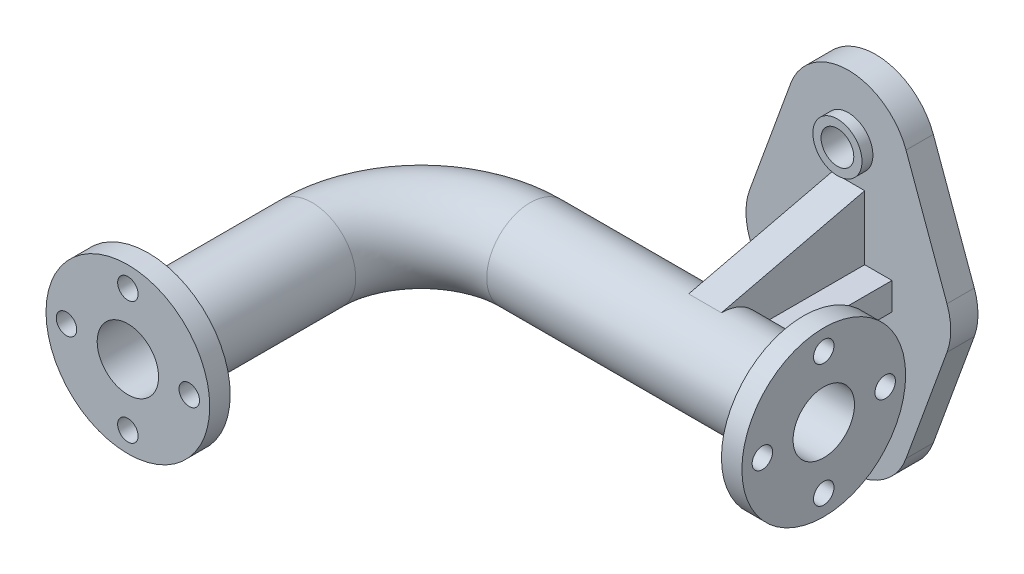
from build123d import *

# Parameters (mm, degrees)
SWEEP_THIN1_PROFILE_R    = 32
SWEEP_THIN1_PROFILE_R_2  = 22.5
BOSS_EXTRUDE1_START      = -15
SKETCH14_R               = 60
SKETCH14_R_2             = 22.5
SKETCH14_R_3             = 7.5
BOSS_EXTRUDE1_DEPTH      = 15
BOSS_EXTRUDE2_START      = 15
SKETCH15_R               = 60
SKETCH15_R_2             = 7.5
SKETCH15_R_3             = 22.5
BOSS_EXTRUDE2_DEPTH      = 15
SKETCH16_R               = 12
BOSS_EXTRUDE3_DEPTH      = 20
EXTRUDE_THIN1_REACH      = 455.521
EXTRUDE_THIN1_END_RADIUS = 32
SKETCH17_W               = 64
SKETCH17_H               = 20
RIB1_START               = -12
RIB1_DEPTH               = 24
SKETCH20_R               = 18
SKETCH20_R_2             = 12
BOSS_EXTRUDE4_DEPTH      = 8


# Read off the part's stored shape, not the designer's step: Rib1
with BuildPart() as part:
    # Sweep-Thin1: sweep along a path in Sketch1
    with BuildLine(Plane(origin=(0, 0, 0), x_dir=(-1, 0, 0), z_dir=(0, 1, 0))) as sweep_thin1_path:
        Line((0, 0), (0, -135))
        ThreePointArc((0, -135), (-23.431457505, -191.568542495), (-80, -215))
        Line((-80, -215), (-280, -215))
    # Sweep-Thin1 profile (on start of the path) → Sweep-Thin1 (sweep)
    with BuildSketch(Plane(origin=(0, 0, 0), x_dir=(-1, 0, 0), z_dir=(0, 0, -1))):
        Circle(SWEEP_THIN1_PROFILE_R)
        Circle(SWEEP_THIN1_PROFILE_R_2, mode=Mode.SUBTRACT)
    sweep(path=sweep_thin1_path.line)

    # Sketch14 → Boss-Extrude1 (add)
    with BuildSketch(Plane.XY.offset(BOSS_EXTRUDE1_START)):
        Circle(SKETCH14_R)
        with Locations(Location((0, 0, 0), (0, 0, 180))):
            Circle(SKETCH14_R_2, mode=Mode.SUBTRACT)
        with Locations((0, -45)):
            Circle(SKETCH14_R_3, mode=Mode.SUBTRACT)
        with Locations((-45, 0)):
            Circle(SKETCH14_R_3, mode=Mode.SUBTRACT)
        with Locations((0, 45)):
            Circle(SKETCH14_R_3, mode=Mode.SUBTRACT)
        with Locations((45, 0)):
            Circle(SKETCH14_R_3, mode=Mode.SUBTRACT)
    extrude(amount=BOSS_EXTRUDE1_DEPTH)

    # Sketch15 → Boss-Extrude2 (add)
    with BuildSketch(Plane.YZ.offset(280).offset(BOSS_EXTRUDE2_START)):
        with Locations(Location((0, -215, 0), (0, 0, 270))):
            Circle(SKETCH15_R)
        with Locations(Location((0, -260, 0), (0, 0, 270))):
            Circle(SKETCH15_R_2, mode=Mode.SUBTRACT)
        with Locations(Location((0, -215, 0), (0, 0, 270))):
            Circle(SKETCH15_R_3, mode=Mode.SUBTRACT)
        with Locations(Location((-45, -215, 0), (0, 0, 270))):
            Circle(SKETCH15_R_2, mode=Mode.SUBTRACT)
        with Locations(Location((0, -170, 0), (0, 0, 270))):
            Circle(SKETCH15_R_2, mode=Mode.SUBTRACT)
        with Locations(Location((45, -215, 0), (0, 0, 270))):
            Circle(SKETCH15_R_2, mode=Mode.SUBTRACT)
    extrude(amount=-BOSS_EXTRUDE2_DEPTH)



with BuildPart() as body_2:
    # Sketch16 → Boss-Extrude3 (new body)
    with BuildSketch(Plane(origin=(0, 0, -340), x_dir=(0, -1, 0), z_dir=(0, 0, 1))):
        with BuildLine():
            Line((15.39090645, 280.313712262), (97.89090645, 250.286167935))
            ThreePointArc((97.89090645, 250.286167935), (127.5, 208), (97.89090645, 165.713832065))
            Line((97.89090645, 165.713832065), (15.39090645, 135.686287738))
            ThreePointArc((15.39090645, 135.686287738), (0, 132.972455673), (-15.39090645, 135.686287738))
            Line((-15.39090645, 135.686287738), (-97.89090645, 165.713832065))
            ThreePointArc((-97.89090645, 165.713832065), (-127.5, 208), (-97.89090645, 250.286167935))
            Line((-97.89090645, 250.286167935), (-15.39090645, 280.313712262))
            ThreePointArc((-15.39090645, 280.313712262), (0, 283.027544327), (15.39090645, 280.313712262))
        make_face()
        with Locations(Location((82.5, 208, 0), (0, 0, 90))):
            Circle(SKETCH16_R, mode=Mode.SUBTRACT)
        with Locations(Location((-82.5, 208, 0), (0, 0, 90))):
            Circle(SKETCH16_R, mode=Mode.SUBTRACT)
    extrude(amount=BOSS_EXTRUDE3_DEPTH)


with BuildPart() as part_1:
    add(part.part)

    add(body_2.part)  # Extrude-Thin1 merges body 2
    # Extrude-Thin1: up to this cylinder (the profile starts outside it)
    extrude_thin1_end = Plane(origin=(208, 0, -215), z_dir=(1, 0, 0)) * Cylinder(EXTRUDE_THIN1_END_RADIUS, 976.042, mode=Mode.PRIVATE)
    # Sketch17 → Extrude-Thin1 (add, up to the surface)
    with BuildSketch(Plane.XY.offset(-320), mode=Mode.PRIVATE) as extrude_thin1_sk1:
        with Locations((208, 0)):
            Rectangle(SKETCH17_W, SKETCH17_H)
    extrude_thin1_tool1 = extrude(extrude_thin1_sk1.sketch, amount=EXTRUDE_THIN1_REACH, mode=Mode.PRIVATE) - extrude_thin1_end
    add(extrude_thin1_tool1.solids().sort_by_distance((208, 0, -320))[0])

    # Rib1 outline → Rib1 (add)
    with BuildSketch(Plane.YZ.offset(208).offset(RIB1_START)):
        with BuildLine():
            Line((57, -320), (32, -215))
            ThreePointArc((32, -215), (25.922962794, -233.761663039), (10, -245.397368307))
            Line((10, -245.397368307), (10, -320))
            Line((10, -320), (57, -320))
        make_face()
    rib1 = extrude(amount=RIB1_DEPTH)

    # Mirror1: Rib1 across plane
    add(rib1.mirror(Plane.ZX))

    # Sketch20 → Boss-Extrude4 (add)
    # profile 1 of 2: a face of its own
    with BuildSketch(Plane.XY.offset(-320)):
        with Locations(Location((208, 82.5, 0), (0, 0, 180))):
            Circle(SKETCH20_R)
        with Locations((208, 82.5)):
            Circle(SKETCH20_R_2, mode=Mode.SUBTRACT)
    # profile 2 of 2: a face of its own
    with BuildSketch(Plane.XY.offset(-320)):
        with Locations(Location((208, -82.5, 0), (0, 0, 180))):
            Circle(SKETCH20_R)
        with Locations((208, -82.5)):
            Circle(SKETCH20_R_2, mode=Mode.SUBTRACT)
    extrude(amount=BOSS_EXTRUDE4_DEPTH)


solid = part_1.part
